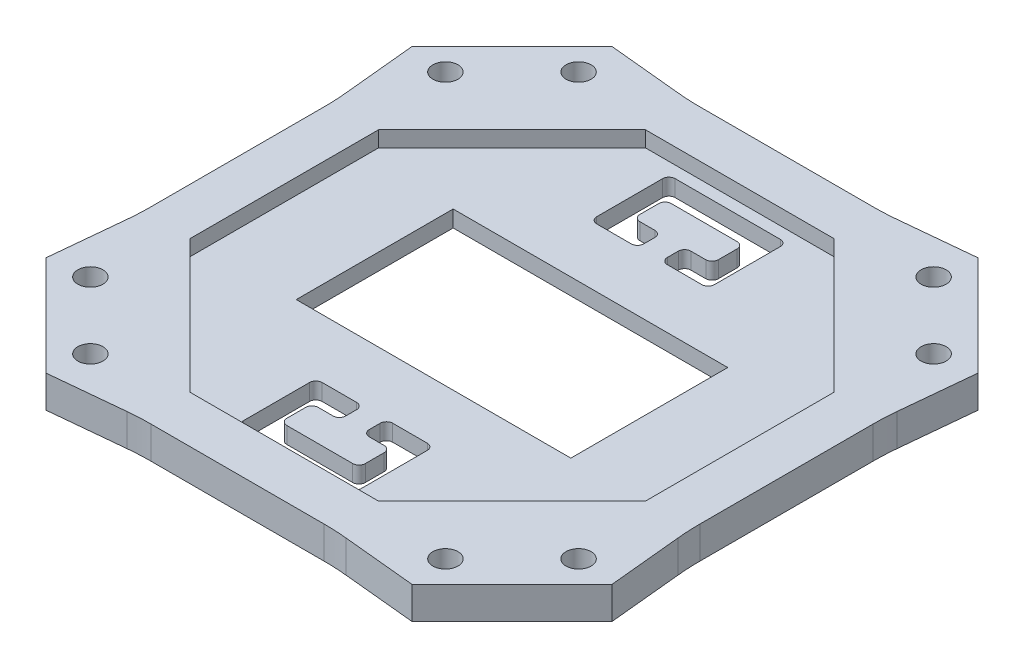
from build123d import *

# Parameters (mm, degrees)
SKETCH2_R           = 1.6
BOSS_EXTRUDE1_DEPTH = 4.1
CUT_EXTRUDE1_DEPTH  = 2
FILLET4_R           = 30
CUT_EXTRUDE4_DEPTH  = 52.043216983
SKETCH9_W           = 35
SKETCH9_H           = 20
CUT_EXTRUDE5_DEPTH  = 52.043216983


with BuildPart() as part:
    # Sketch2 → Boss-Extrude1 (new body)
    with BuildSketch(Plane(origin=(0, 0, 0), x_dir=(1, 0, 0), z_dir=(0, 1, 0))):
        Polygon((-12.5, 35), (12.5, 35), (23.334523779, 36.062445841), (36.062445841, 23.334523779), (35, 12.5), (35, -12.5), (36.062445841, -23.334523779), (23.334523779, -36.062445841), (12.5, -35), (-12.5, -35), (-23.334523779, -36.062445841), (-36.062445841, -23.334523779), (-35, -12.5), (-35, 12.5), (-36.062445841, 23.334523779), (-23.334523779, 36.062445841), align=None)
        with Locations(Location((22.627416998, 31.112698372, 0), (0, 0, 270))):
            Circle(SKETCH2_R, mode=Mode.SUBTRACT)
        with Locations(Location((31.112698372, 22.627416998, 0), (0, 0, 270))):
            Circle(SKETCH2_R, mode=Mode.SUBTRACT)
        with Locations(Location((22.627416998, -31.112698372, 0), (0, 0, 270))):
            Circle(SKETCH2_R, mode=Mode.SUBTRACT)
        with Locations(Location((31.112698372, -22.627416998, 0), (0, 0, 270))):
            Circle(SKETCH2_R, mode=Mode.SUBTRACT)
        with Locations(Location((-31.112698372, -22.627416998, 0), (0, 0, 270))):
            Circle(SKETCH2_R, mode=Mode.SUBTRACT)
        with Locations(Location((-22.627416998, -31.112698372, 0), (0, 0, 270))):
            Circle(SKETCH2_R, mode=Mode.SUBTRACT)
        with Locations(Location((-22.627416998, 31.112698372, 0), (0, 0, 270))):
            Circle(SKETCH2_R, mode=Mode.SUBTRACT)
        with Locations(Location((-31.112698372, 22.627416998, 0), (0, 0, 270))):
            Circle(SKETCH2_R, mode=Mode.SUBTRACT)
    extrude(amount=BOSS_EXTRUDE1_DEPTH)

    # Sketch4 → Cut-Extrude1 (cut)
    with BuildSketch(Plane(origin=(0, 4.1, 0), x_dir=(1, 0, 0), z_dir=(0, 1, 0))):
        Polygon((29, 12.012193309), (12.012193309, 29), (-12.012193309, 29), (-29, 12.012193309), (-29, -12.012193309), (-12.012193309, -29), (12.012193309, -29), (29, -12.012193309), align=None)
    extrude(amount=-CUT_EXTRUDE1_DEPTH, mode=Mode.SUBTRACT)

    # Fillet4
    # the kernel refuses this fillet: 30 mm, written as the material it adds along each edge
    with BuildSketch(Plane(origin=(35, 0, -12.5), x_dir=(0.09759304388629828, 0, -0.9952264052892723), z_dir=(0, 1, 0)), Plane(origin=(35, 0, 12.5), x_dir=(0, 0, -1), z_dir=(0, 1, 0)), Plane(origin=(12.5, 0, 35), x_dir=(0.9952264052892723, 0, 0.09759304388629875), z_dir=(0, 1, 0)), Plane(origin=(-12.5, 0, 35), x_dir=(1, 0, 0), z_dir=(0, 1, 0)), Plane(origin=(-35, 0, 12.5), x_dir=(-0.09759304388630283, 0, 0.9952264052892719), z_dir=(0, 1, 0)), Plane(origin=(-35, 0, -12.5), x_dir=(0, 0, 1), z_dir=(0, 1, 0)), Plane(origin=(12.5, 0, -35), x_dir=(-1, 0, 0), z_dir=(0, 1, 0))) as fillet4_piece_1:
        with BuildLine():
            CenterArc((FILLET4_R * 0.0489132680019, -FILLET4_R), FILLET4_R, 90, 5.600584003)
            Line((-FILLET4_R * 0.0486797758844, -FILLET4_R * 0.00477359471073), (0, 0))
            Line((0, 0), (FILLET4_R * 0.0489132680019, 0))
        make_face()
    extrude(amount=4.1)
    with BuildSketch(Plane(origin=(-12.5, 0, -35), x_dir=(1, 0, 0), z_dir=(0, 1, 0))) as fillet4_piece_2:
        with BuildLine():
            CenterArc((FILLET4_R * 0.0489132680019, FILLET4_R), FILLET4_R, 264.399415997, 5.600584003)
            Line((-FILLET4_R * 0.0486797758844, FILLET4_R * 0.00477359471073), (0, 0))
            Line((0, 0), (FILLET4_R * 0.0489132680019, 0))
        make_face()
    extrude(amount=4.1)

    # Sketch8 → Cut-Extrude4 (cut, through all)
    with BuildSketch(Plane(origin=(0, 2.1, 0), x_dir=(1, 0, 0), z_dir=(0, 1, 0))):
        with BuildLine():
            Line((-1.5, 19.7), (-1.5, 18.3))
            ThreePointArc((-1.5, 18.3), (-1.734314575, 17.734314575), (-2.3, 17.5))
            Line((-2.3, 17.5), (-6.7, 17.5))
            ThreePointArc((-6.7, 17.5), (-7.265685425, 17.734314575), (-7.5, 18.3))
            Line((-7.5, 18.3), (-7.5, 26.7))
            ThreePointArc((-7.5, 26.7), (-7.265685425, 27.265685425), (-6.7, 27.5))
            Line((-6.7, 27.5), (6.7, 27.5))
            ThreePointArc((6.7, 27.5), (7.265685425, 27.265685425), (7.5, 26.7))
            Line((7.5, 26.7), (7.5, 18.3))
            ThreePointArc((7.5, 18.3), (7.265685425, 17.734314575), (6.7, 17.5))
            Line((6.7, 17.5), (2.3, 17.5))
            ThreePointArc((2.3, 17.5), (1.734314575, 17.734314575), (1.5, 18.3))
            Line((1.5, 18.3), (1.5, 19.7))
            ThreePointArc((1.5, 19.7), (1.734314575, 20.265685425), (2.3, 20.5))
            Line((2.3, 20.5), (4.2, 20.5))
            ThreePointArc((4.2, 20.5), (4.765685425, 20.734314575), (5, 21.3))
            Line((5, 21.3), (5, 23.7))
            ThreePointArc((5, 23.7), (4.765685425, 24.265685425), (4.2, 24.5))
            Line((4.2, 24.5), (-4.2, 24.5))
            ThreePointArc((-4.2, 24.5), (-4.765685425, 24.265685425), (-5, 23.7))
            Line((-5, 23.7), (-5, 21.3))
            ThreePointArc((-5, 21.3), (-4.765685425, 20.734314575), (-4.2, 20.5))
            Line((-4.2, 20.5), (-2.3, 20.5))
            ThreePointArc((-2.3, 20.5), (-1.734314575, 20.265685425), (-1.5, 19.7))
        make_face()
        with BuildLine():
            Line((-7.5, -18.3), (-7.5, -26.7))
            ThreePointArc((-7.5, -26.7), (-7.265685425, -27.265685425), (-6.7, -27.5))
            Line((-6.7, -27.5), (6.7, -27.5))
            ThreePointArc((6.7, -27.5), (7.265685425, -27.265685425), (7.5, -26.7))
            Line((7.5, -26.7), (7.5, -18.3))
            ThreePointArc((7.5, -18.3), (7.265685425, -17.734314575), (6.7, -17.5))
            Line((6.7, -17.5), (2.3, -17.5))
            ThreePointArc((2.3, -17.5), (1.734314575, -17.734314575), (1.5, -18.3))
            Line((1.5, -18.3), (1.5, -19.7))
            ThreePointArc((1.5, -19.7), (1.734314575, -20.265685425), (2.3, -20.5))
            Line((2.3, -20.5), (4.2, -20.5))
            ThreePointArc((4.2, -20.5), (4.765685425, -20.734314575), (5, -21.3))
            Line((5, -21.3), (5, -23.7))
            ThreePointArc((5, -23.7), (4.765685425, -24.265685425), (4.2, -24.5))
            Line((4.2, -24.5), (-4.2, -24.5))
            ThreePointArc((-4.2, -24.5), (-4.765685425, -24.265685425), (-5, -23.7))
            Line((-5, -23.7), (-5, -21.3))
            ThreePointArc((-5, -21.3), (-4.765685425, -20.734314575), (-4.2, -20.5))
            Line((-4.2, -20.5), (-2.3, -20.5))
            ThreePointArc((-2.3, -20.5), (-1.734314575, -20.265685425), (-1.5, -19.7))
            Line((-1.5, -19.7), (-1.5, -18.3))
            ThreePointArc((-1.5, -18.3), (-1.734314575, -17.734314575), (-2.3, -17.5))
            Line((-2.3, -17.5), (-6.7, -17.5))
            ThreePointArc((-6.7, -17.5), (-7.265685425, -17.734314575), (-7.5, -18.3))
        make_face()
    extrude(amount=-CUT_EXTRUDE4_DEPTH, mode=Mode.SUBTRACT)

    # Sketch9 → Cut-Extrude5 (cut, through all)
    with BuildSketch(Plane(origin=(0, 2.1, 0), x_dir=(1, 0, 0), z_dir=(0, 1, 0))):
        Rectangle(SKETCH9_W, SKETCH9_H)
    extrude(amount=-CUT_EXTRUDE5_DEPTH, mode=Mode.SUBTRACT)


solid = part.part
